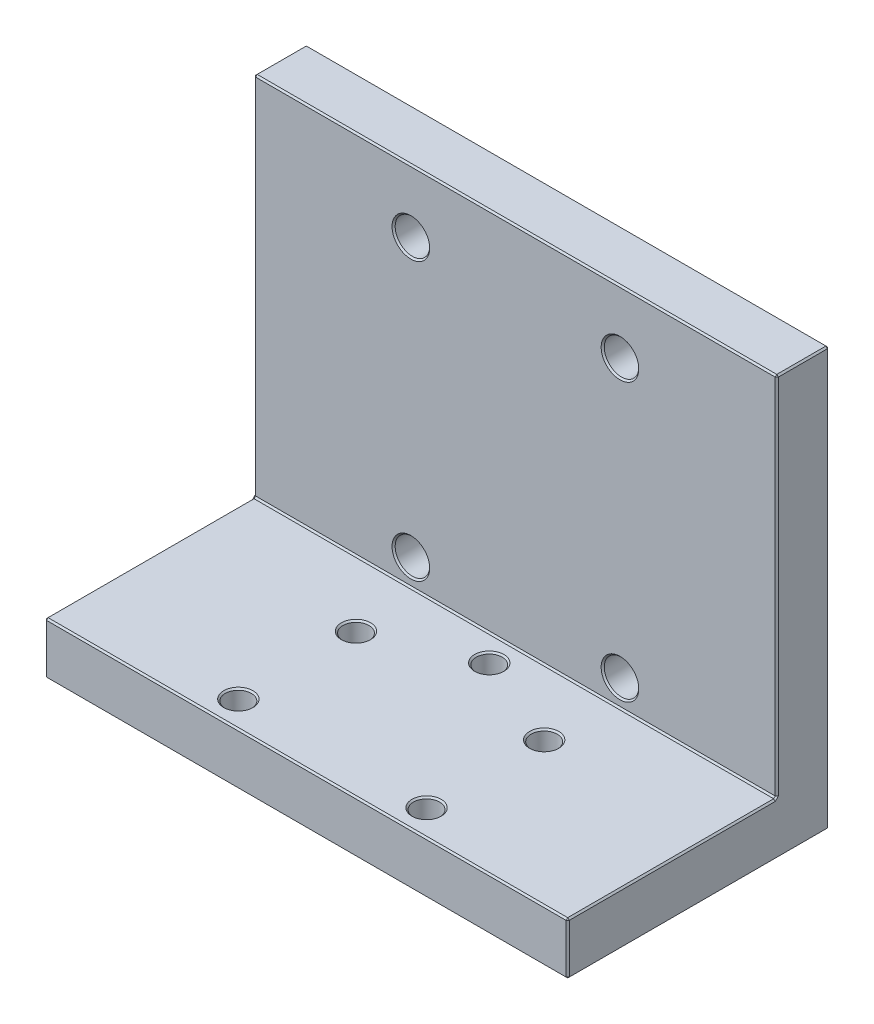
from build123d import *

# Parameters (mm, degrees)
BOSS_EXTRUDE1_DEPTH = 50
SKETCH2_R           = 3.3
CUT_EXTRUDE1_DEPTH  = 100
SKETCH3_R           = 2.5
CUT_EXTRUDE2_DEPTH  = 100
CHAMFER1_SIZE       = 0.3


with BuildPart() as part:
    # Sketch1 → Boss-Extrude1 (new, symmetric)
    with BuildSketch(Plane(origin=(0, 0, 0), x_dir=(0, 0, -1), z_dir=(1, 0, 0))):
        Polygon((0, 0), (0, 80), (-10, 80), (-10, 10), (-50, 10), (-50, 0), align=None)
    extrude(amount=BOSS_EXTRUDE1_DEPTH, both=True)

    # Sketch2 → Cut-Extrude1 (cut)
    with BuildSketch(Plane.XY.offset(10)):
        with Locations((-20, 68)):
            Circle(SKETCH2_R)
        with Locations((20, 68)):
            Circle(SKETCH2_R)
        with Locations((20, 15)):
            Circle(SKETCH2_R)
        with Locations((-20, 15)):
            Circle(SKETCH2_R)
    extrude(amount=-CUT_EXTRUDE1_DEPTH, mode=Mode.SUBTRACT)

    # Sketch3 → Cut-Extrude2 (cut)
    with BuildSketch(Plane(origin=(0, 10, 0), x_dir=(1, 0, 0), z_dir=(0, 1, 0))):
        with Locations((-18, -22.5)):
            Circle(SKETCH3_R)
        with Locations((-18, -45)):
            Circle(SKETCH3_R)
        with Locations((18, -45)):
            Circle(SKETCH3_R)
        with Locations((18, -22.5)):
            Circle(SKETCH3_R)
        with Locations((0, -15)):
            Circle(SKETCH3_R)
    extrude(amount=-CUT_EXTRUDE2_DEPTH, mode=Mode.SUBTRACT)

    # Chamfer1
    chamfer1_edges = [part.edges().sort_by_distance(p)[0] for p in [
        (-20.5, 10, 22.5),
        (-20.5, 10, 45),
        (15.5, 10, 45),
        (15.5, 10, 22.5),
        (-2.5, 10, 15),
        (-23.3, 68, 10),
        (16.7, 68, 10),
        (16.7, 15, 10),
        (-23.3, 15, 10),
        (50, 10, 30),
        (0, 10, 50),
        (-50, 10, 30),
        (0, 80, 10),
        (50, 45, 10),
        (0, 10, 10),
        (-50, 45, 10),
        (0, 0, 0),
        (0, 80, 0),
        (50, 5, 50),
        (50, 80, 5),
        (50, 40, 0),
        (50, 0, 25),
        (0, 0, 50),
        (-50, 5, 50),
        (-50, 80, 5),
        (-50, 40, 0),
        (-50, 0, 25),
        (-23.3, 68, 0),
        (16.7, 68, 0),
        (16.7, 15, 0),
        (-23.3, 15, 0),
        (-20.5, 0, 22.5),
        (-20.5, 0, 45),
        (15.5, 0, 45),
        (15.5, 0, 22.5),
        (-2.5, 0, 15),
    ]]
    chamfer(chamfer1_edges, length=CHAMFER1_SIZE)


solid = part.part
